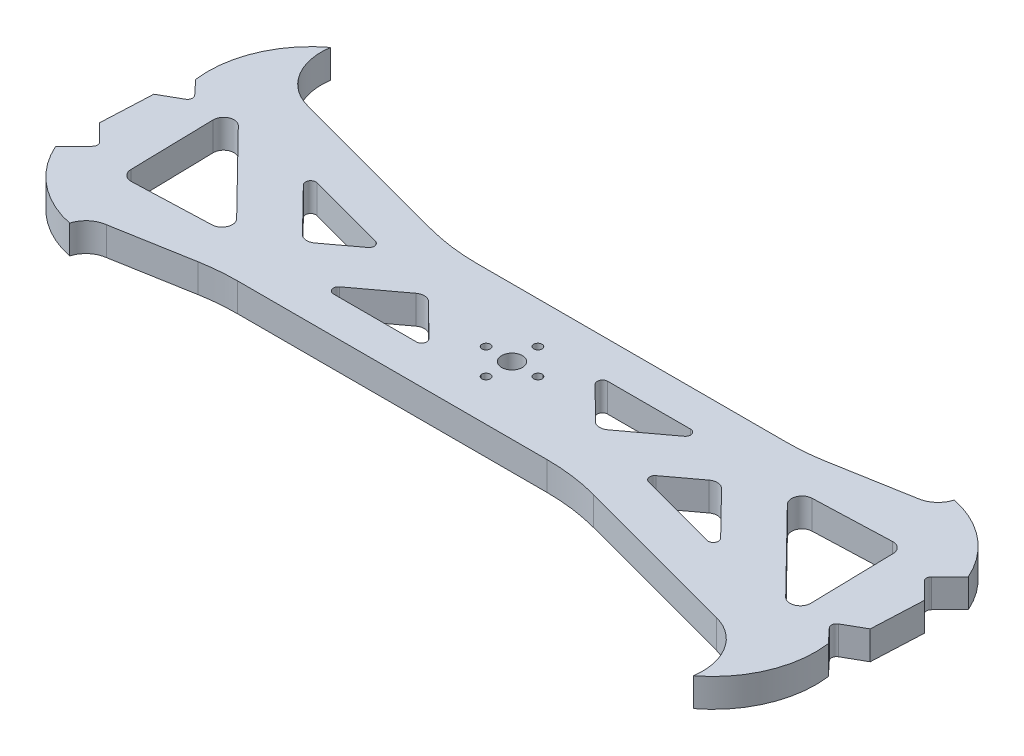
from build123d import *

# Parameters (mm, degrees)
SKETCH1_W           = 203.2
SKETCH1_H           = 88.9
BOSS_EXTRUDE1_DEPTH = 3.4925
CUT_EXTRUDE1_DEPTH  = 112.11774262
SKETCH3_R           = 2.54
CUT_EXTRUDE2_DEPTH  = 112.11774262
SKETCH4_R           = 1.016
CUT_EXTRUDE3_DEPTH  = 112.11774262
CIRPATTERN1_COUNT   = 4
FILLET1_R           = 2.54
FILLET2_R           = 1.27
FILLET3_R           = 2.54
FILLET5_R           = 1.27
FILLET6_R           = 50.8
FILLET7_R           = 12.7
FILLET8_R           = 50.8


with BuildPart() as part:
    # Sketch1 → Boss-Extrude1 (new, symmetric)
    with BuildSketch(Plane(origin=(0, 0, 0), x_dir=(1, 0, 0), z_dir=(0, 1, 0))):
        Rectangle(SKETCH1_W, SKETCH1_H)
    extrude(amount=BOSS_EXTRUDE1_DEPTH, both=True)

    # Sketch2 → Cut-Extrude1 (cut, through all)
    with BuildSketch(Plane(origin=(0, 3.4925, 0), x_dir=(1, 0, 0), z_dir=(0, 1, 0))):
        with BuildLine():
            Line((-31.75, 16.51), (55.245, 16.51))
            Line((55.245, 16.51), (78.74, 20.652802412))
            ThreePointArc((78.74, 20.652802412), (81.788538241, 22.014606031), (83.593324449, 24.823670155))
            ThreePointArc((83.593324449, 24.823670155), (94.360710066, 19.694504726), (101.6, 10.216234194))
            Line((101.6, 10.216234194), (101.6, 44.45))
            Line((101.6, 44.45), (-88.9, 44.45))
            ThreePointArc((-88.9, 44.45), (-87.492261581, 35.867831657), (-81.28, 29.781523501))
            Line((-81.28, 29.781523501), (-31.75, 16.51))
        make_face()
        with BuildLine():
            ThreePointArc((-98.638568081, 21.104370835), (-96.913748623, 34.088890585), (-88.9, 44.45))
            Line((-88.9, 44.45), (-101.6, 44.45))
            Line((-101.6, 44.45), (-101.6, -10.216234194))
            Line((-101.6, -10.216234194), (-96.21868527, -4.834919464))
            Line((-96.21868527, -4.834919464), (-101.214477769, 0.160873034))
            Line((-101.214477769, 0.160873034), (-100.632938366, 12.847551556))
            Line((-100.632938366, 12.847551556), (-94.300535983, 16.467132701))
            Line((-94.300535983, 16.467132701), (-98.638568081, 21.104370835))
        make_face()
        with BuildLine():
            Line((101.6, -44.45), (101.6, 10.216234194))
            Line((101.6, 10.216234194), (96.21868527, 4.834919464))
            Line((96.21868527, 4.834919464), (101.214477769, -0.160873034))
            Line((101.214477769, -0.160873034), (100.632938366, -12.847551556))
            Line((100.632938366, -12.847551556), (94.300535983, -16.467132701))
            Line((94.300535983, -16.467132701), (98.638568081, -21.104370835))
            ThreePointArc((98.638568081, -21.104370835), (96.913748623, -34.088890585), (88.9, -44.45))
            Line((88.9, -44.45), (101.6, -44.45))
        make_face()
        with BuildLine():
            ThreePointArc((-83.593324449, -24.823670155), (-94.360710066, -19.694504726), (-101.6, -10.216234194))
            Line((-101.6, -10.216234194), (-101.6, -44.45))
            Line((-101.6, -44.45), (88.9, -44.45))
            ThreePointArc((88.9, -44.45), (87.492261581, -35.867831657), (81.28, -29.781523501))
            Line((81.28, -29.781523501), (31.75, -16.51))
            Line((31.75, -16.51), (-55.245, -16.51))
            Line((-55.245, -16.51), (-78.74, -20.652802412))
            ThreePointArc((-78.74, -20.652802412), (-81.788538241, -22.014606031), (-83.593324449, -24.823670155))
        make_face()
        Polygon((88.05700307, -21.079010008), (87.398119112, 8.529749379), (60.021879406, 7.543003672), align=None)
        Polygon((24.488345728, -4.045839609), (40.052106774, 7.543003672), (12.822526778, 7.543003672), align=None)
        Polygon((39.742370722, -8.133143288), (66.320169477, -15.254643001), (51.077542694, 0.30707442), align=None)
        Polygon((-88.05700307, 21.079010008), (-87.398119112, -8.529749379), (-60.021879406, -7.543003672), align=None)
        Polygon((-24.488345728, 4.045839609), (-40.052106774, -7.543003672), (-12.822526778, -7.543003672), align=None)
        Polygon((-39.742370722, 8.133143288), (-66.320169477, 15.254643001), (-51.077542694, -0.30707442), align=None)
    extrude(amount=-CUT_EXTRUDE1_DEPTH, mode=Mode.SUBTRACT)

    # Sketch3 → Cut-Extrude2 (cut, through all)
    with BuildSketch(Plane(origin=(0, 3.4925, 0), x_dir=(1, 0, 0), z_dir=(0, 1, 0))):
        Circle(SKETCH3_R)
    extrude(amount=-CUT_EXTRUDE2_DEPTH, mode=Mode.SUBTRACT)

    # Sketch4 → Cut-Extrude3 (cut, through all)
    with BuildSketch(Plane(origin=(0, 3.4925, 0), x_dir=(1, 0, 0), z_dir=(0, 1, 0))):
        with Locations((0, -6.35)):
            Circle(SKETCH4_R)
    cut_extrude3 = extrude(amount=-CUT_EXTRUDE3_DEPTH, mode=Mode.SUBTRACT)

    # CirPattern1: Cut-Extrude3 ×4 about axis
    cirpattern1_axis = Axis((0, 3.4925, 0), (0, 1, 0))
    for i in range(1, CIRPATTERN1_COUNT):
        add(cut_extrude3.rotate(cirpattern1_axis, i * 360 / CIRPATTERN1_COUNT), mode=Mode.SUBTRACT)

    # Fillet1
    fillet1_edges = [part.edges().sort_by_distance(p)[0] for p in [
        (-60.021879406, 0, 7.543003672),
        (-87.398119112, 0, 8.529749379),
        (-88.05700307, 0, -21.079010008),
        (51.077542694, 0, -0.30707442),
        (88.05700307, 0, 21.079010008),
        (60.021879406, 0, -7.543003672),
        (87.398119112, 0, -8.529749379),
    ]]
    fillet(fillet1_edges, radius=FILLET1_R)

    # Fillet2
    fillet2_edges = [part.edges().sort_by_distance(p)[0] for p in [
        (-66.320169477, 0, -15.254643001),
        (-39.742370722, 0, -8.133143288),
        (-40.052106774, 0, 7.543003672),
        (-12.822526778, 0, 7.543003672),
        (12.822526778, 0, -7.543003672),
        (40.052106774, 0, -7.543003672),
        (39.742370722, 0, 8.133143288),
        (66.320169477, 0, 15.254643001),
    ]]
    fillet(fillet2_edges, radius=FILLET2_R)

    # Fillet3
    fillet3_edges = [part.edges().sort_by_distance(p)[0] for p in [
        (24.488345728, 0, 4.045839609),
        (-24.488345728, 0, -4.045839609),
        (-51.077542694, 0, 0.30707442),
    ]]
    fillet(fillet3_edges, radius=FILLET3_R)

    # Fillet5
    fillet5_edges = [part.edges().sort_by_distance(p)[0] for p in [
        (94.300535983, 0, 16.467132701),
        (96.21868527, 0, -4.834919464),
        (-94.300535983, 0, -16.467132701),
        (-96.21868527, 0, 4.834919464),
    ]]
    fillet(fillet5_edges, radius=FILLET5_R)

    # Fillet6
    fillet6_edges = [part.edges().sort_by_distance(p)[0] for p in [
        (-31.75, 0, -16.51),
        (31.75, 0, 16.51),
    ]]
    fillet(fillet6_edges, radius=FILLET6_R)

    # Fillet7
    fillet7_edges = [part.edges().sort_by_distance(p)[0] for p in [
        (81.28, 0, 29.781523501),
        (-81.28, 0, -29.781523501),
    ]]
    fillet(fillet7_edges, radius=FILLET7_R)

    # Fillet8
    fillet8_edges = [part.edges().sort_by_distance(p)[0] for p in [
        (55.245, 0, -16.51),
        (-55.245, 0, 16.51),
    ]]
    fillet(fillet8_edges, radius=FILLET8_R)


solid = part.part
